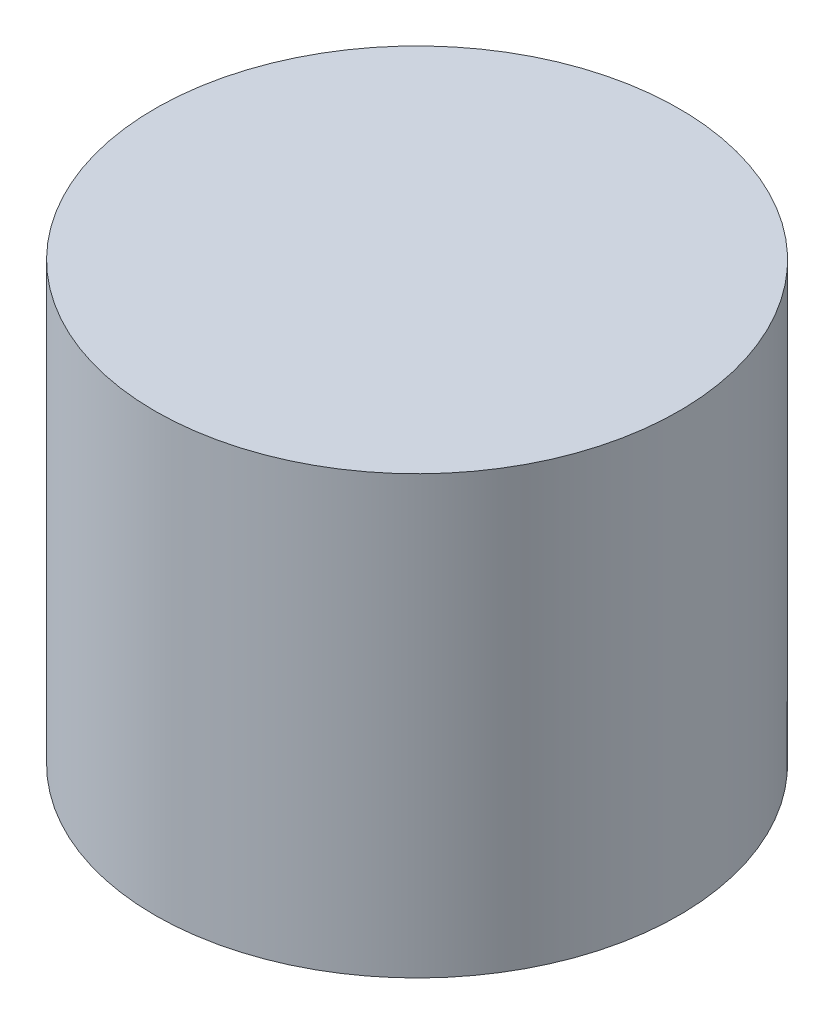
from build123d import *

# Parameters (mm, degrees)
SKETCH1_R           = 30
BOSS_EXTRUDE1_DEPTH = 50


with BuildPart() as part:
    # Sketch1 → Boss-Extrude1 (new body)
    with BuildSketch(Plane(origin=(0, 0, 0), x_dir=(1, 0, 0), z_dir=(0, 1, 0))):
        Circle(SKETCH1_R)
    extrude(amount=BOSS_EXTRUDE1_DEPTH)


solid = part.part
